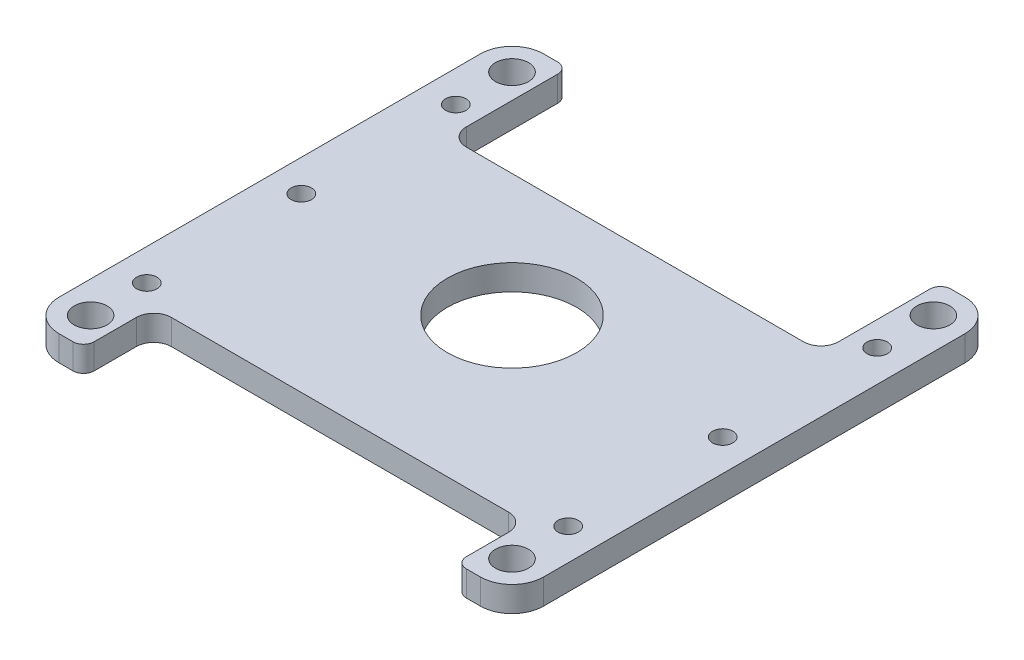
from build123d import *

# Parameters (mm, degrees)
SKETCH1_W           = 70
SKETCH1_H           = 70
BOSS_EXTRUDE1_DEPTH = 3.6
SKETCH2_W           = 87.76827376
SKETCH2_H           = 85.716468358
CUT_EXTRUDE1_DEPTH  = 10
SKETCH4_R           = 2.35
SKETCH4_R_2         = 1.45
SKETCH4_R_3         = 9.2
CUT_EXTRUDE2_DEPTH  = 10


with BuildPart() as part:
    # Sketch1 → Boss-Extrude1 (new body)
    with BuildSketch(Plane(origin=(0, 0, 0), x_dir=(1, 0, 0), z_dir=(0, 1, 0))):
        Rectangle(SKETCH1_W, SKETCH1_H)
    extrude(amount=BOSS_EXTRUDE1_DEPTH)

    # Sketch2 → Cut-Extrude1 (cut)
    with BuildSketch(Plane(origin=(0, 3.6, 0), x_dir=(1, 0, 0), z_dir=(0, 1, 0))):
        Rectangle(SKETCH2_W, SKETCH2_H)
        with BuildLine():
            Line((30, 34.5), (28, 34.5))
            ThreePointArc((28, 34.5), (26.939339828, 34.060660172), (26.5, 33))
            Line((26.5, 33), (26.5, 20))
            ThreePointArc((26.5, 20), (25.767766953, 18.232233047), (24, 17.5))
            Line((24, 17.5), (-24, 17.5))
            ThreePointArc((-24, 17.5), (-25.767766953, 18.232233047), (-26.5, 20))
            Line((-26.5, 20), (-26.5, 33))
            ThreePointArc((-26.5, 33), (-26.939339828, 34.060660172), (-28, 34.5))
            Line((-28, 34.5), (-30, 34.5))
            ThreePointArc((-30, 34.5), (-33.181980515, 33.181980515), (-34.5, 30))
            Line((-34.5, 30), (-34.5, -30))
            ThreePointArc((-34.5, -30), (-33.181980515, -33.181980515), (-30, -34.5))
            Line((-30, -34.5), (-28, -34.5))
            ThreePointArc((-28, -34.5), (-26.939339828, -34.060660172), (-26.5, -33))
            Line((-26.5, -33), (-26.5, -27))
            ThreePointArc((-26.5, -27), (-25.767766953, -25.232233047), (-24, -24.5))
            Line((-24, -24.5), (24, -24.5))
            ThreePointArc((24, -24.5), (25.767766953, -25.232233047), (26.5, -27))
            Line((26.5, -27), (26.5, -33))
            ThreePointArc((26.5, -33), (26.939339828, -34.060660172), (28, -34.5))
            Line((28, -34.5), (30, -34.5))
            ThreePointArc((30, -34.5), (33.181980515, -33.181980515), (34.5, -30))
            Line((34.5, -30), (34.5, 30))
            ThreePointArc((34.5, 30), (33.181980515, 33.181980515), (30, 34.5))
        make_face(mode=Mode.SUBTRACT)
    extrude(amount=-CUT_EXTRUDE1_DEPTH, mode=Mode.SUBTRACT)

    # Sketch4 → Cut-Extrude2 (cut)
    with BuildSketch(Plane.XZ):
        with Locations((30, -30)):
            Circle(SKETCH4_R)
        with Locations((30, -22)):
            Circle(SKETCH4_R_2)
        with Locations((30, 0)):
            Circle(SKETCH4_R_2)
        with Locations((30, 22)):
            Circle(SKETCH4_R_2)
        with Locations((30, 30)):
            Circle(SKETCH4_R)
        with Locations((-30, -30)):
            Circle(SKETCH4_R)
        with Locations((-30, -22)):
            Circle(SKETCH4_R_2)
        Circle(SKETCH4_R_3)
        with Locations((-30, 0)):
            Circle(SKETCH4_R_2)
        with Locations((-30, 22)):
            Circle(SKETCH4_R_2)
        with Locations((-30, 30)):
            Circle(SKETCH4_R)
    extrude(amount=-CUT_EXTRUDE2_DEPTH, mode=Mode.SUBTRACT)


solid = part.part
